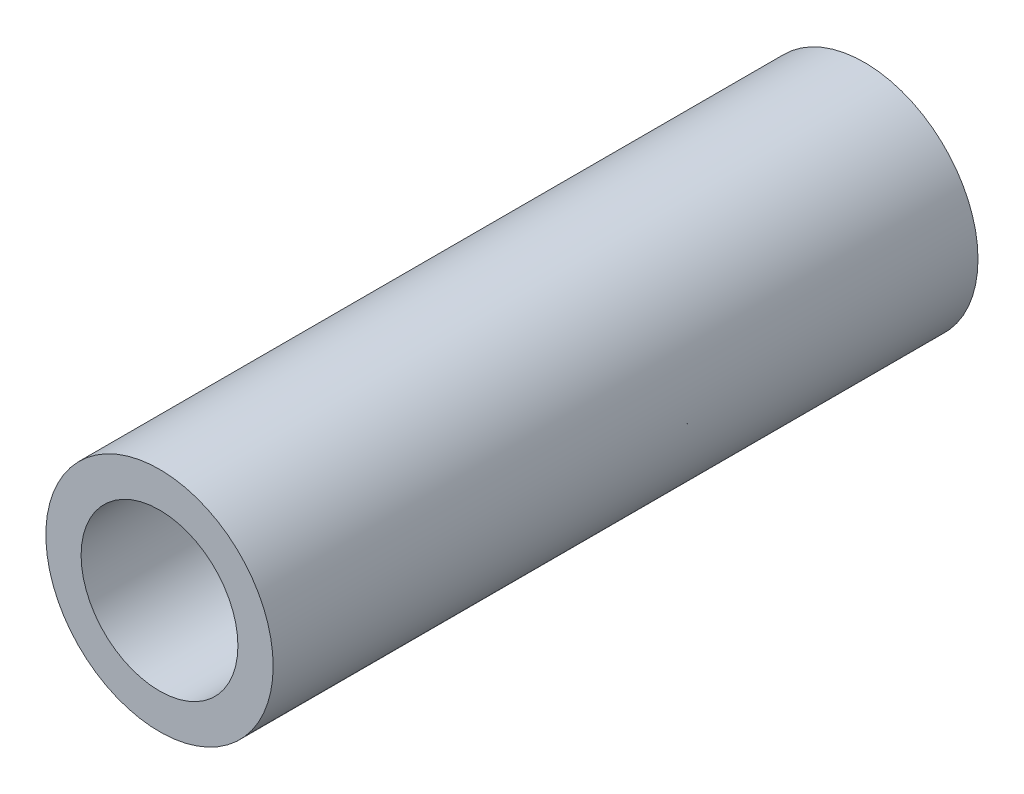
from build123d import *

# Parameters (mm, degrees)
ESQUISSE1_R        = 6.45
ESQUISSE1_R_2      = 4.45
EXTRU_MINCE1_DEPTH = 40
ESQUISSE3_R        = 4.45
BOSS_EXTRU_2_DEPTH = 3


with BuildPart() as part:
    # Esquisse1 → Extru.-Mince1 (new body)
    with BuildSketch(Plane.XY):
        Circle(ESQUISSE1_R)
        Circle(ESQUISSE1_R_2, mode=Mode.SUBTRACT)
    extrude(amount=EXTRU_MINCE1_DEPTH)

    # Esquisse3 → Boss.-Extru.2 (add)
    with BuildSketch(Plane(origin=(0, 0, 0), x_dir=(-1, 0, 0), z_dir=(0, 0, -1))):
        Circle(ESQUISSE3_R)
    extrude(amount=-BOSS_EXTRU_2_DEPTH)


solid = part.part
